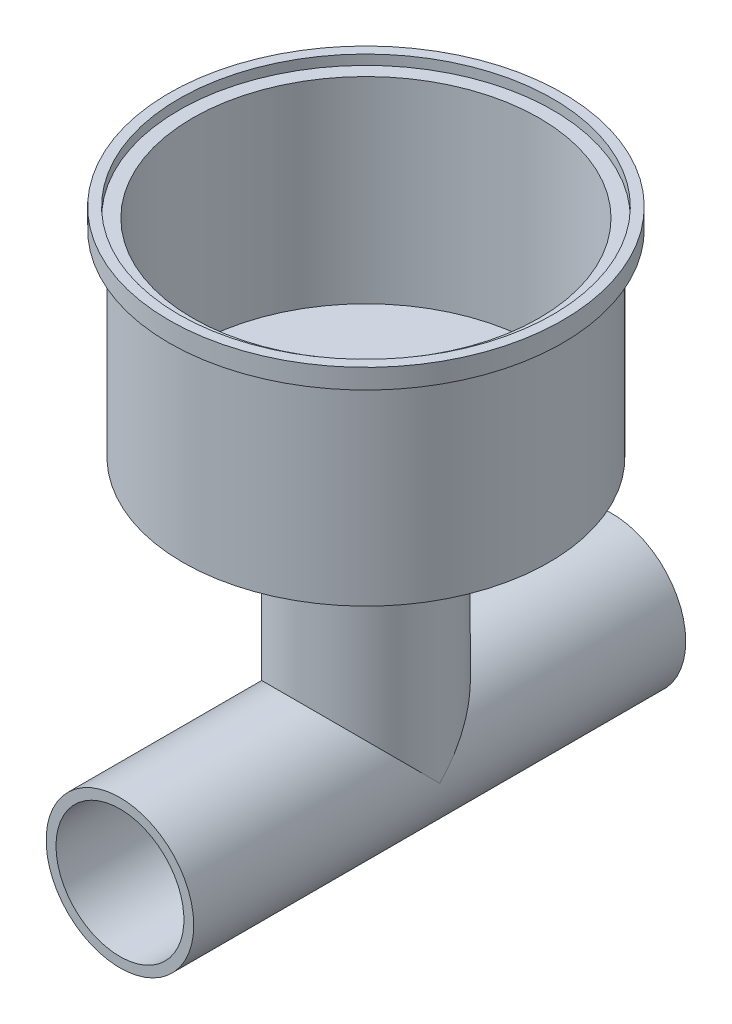
from build123d import *

# Parameters (mm, degrees)
SZKIC1_R                    = 7.5
DODANIE_WYCI_GNI_CIE1_DEPTH = 25
SZKIC3_R                    = 7.5
DODANIE_WYCI_GNI_CIE2_DEPTH = 25
SZKIC4_R                    = 18.61388964
DODANIE_WYCI_GNI_CIE3_DEPTH = 20
SZKIC5_R                    = 20
DODANIE_WYCI_GNI_CIE4_DEPTH = 2
SKORUPA1_START              = 26
SKORUPA1_OUTLINE_R          = 17.61388964
SKORUPA1_DEPTH              = 21
SKORUPA1_START_2            = -1e-07
SKORUPA1_2_OUTLINE_R        = 6.5
SKORUPA1_2_DEPTH            = 26.0000001
SKORUPA1_START_3            = 46
SKORUPA1_3_OUTLINE_R        = 19
SKORUPA1_3_OUTLINE_R_2      = 17.61388964
SKORUPA1_3_DEPTH            = 1
SKORUPA1_START_4            = -24
SKORUPA1_4_OUTLINE_R        = 6.5
SKORUPA1_4_DEPTH            = 48
SZKIC6_R                    = 6.5
WYTNIJ_WYCI_GNI_CIE1_DEPTH  = 72.477269114


with BuildPart() as part:
    # Szkic1 → Dodanie-wyciągnięcie1 (new, symmetric)
    with BuildSketch(Plane.XY):
        Circle(SZKIC1_R)
    extrude(amount=DODANIE_WYCI_GNI_CIE1_DEPTH, both=True)

    # Szkic3 → Dodanie-wyciągnięcie2 (add)
    with BuildSketch(Plane(origin=(0, 0, 0), x_dir=(1, 0, 0), z_dir=(0, 1, 0))):
        Circle(SZKIC3_R)
    extrude(amount=DODANIE_WYCI_GNI_CIE2_DEPTH)

    # Szkic4 → Dodanie-wyciągnięcie3 (add)
    with BuildSketch(Plane(origin=(0, 25, 0), x_dir=(1, 0, 0), z_dir=(0, 1, 0))):
        with Locations(Location((0, 0, 0), (0, 0, 270))):
            Circle(SZKIC4_R)
    extrude(amount=DODANIE_WYCI_GNI_CIE3_DEPTH)

    # Szkic5 → Dodanie-wyciągnięcie4 (add)
    with BuildSketch(Plane(origin=(0, 45, 0), x_dir=(1, 0, 0), z_dir=(0, 1, 0))):
        with Locations(Location((0, 0, 0), (0, 0, 270))):
            Circle(SZKIC5_R)
    extrude(amount=DODANIE_WYCI_GNI_CIE4_DEPTH)

    # Skorupa1: read off the stored shape, not the designer's step
    # Skorupa1 outline → Skorupa1 (cut)
    with BuildSketch(Plane(origin=(0, 0, 0), x_dir=(1, 0, 0), z_dir=(0, 1, 0)).offset(SKORUPA1_START)):
        Circle(SKORUPA1_OUTLINE_R)
    extrude(amount=SKORUPA1_DEPTH, mode=Mode.SUBTRACT)

    # Skorupa1 2 outline → Skorupa1 2 (cut)
    with BuildSketch(Plane(origin=(0, 0, 0), x_dir=(1, 0, 0), z_dir=(0, 1, 0)).offset(SKORUPA1_START_2)):
        Circle(SKORUPA1_2_OUTLINE_R)
    extrude(amount=SKORUPA1_2_DEPTH, mode=Mode.SUBTRACT)

    # Skorupa1 3 outline → Skorupa1 3 (cut)
    with BuildSketch(Plane(origin=(0, 0, 0), x_dir=(1, 0, 0), z_dir=(0, 1, 0)).offset(SKORUPA1_START_3)):
        Circle(SKORUPA1_3_OUTLINE_R)
        Circle(SKORUPA1_3_OUTLINE_R_2, mode=Mode.SUBTRACT)
    extrude(amount=SKORUPA1_3_DEPTH, mode=Mode.SUBTRACT)

    # Skorupa1 4 outline → Skorupa1 4 (cut)
    with BuildSketch(Plane.XY.offset(SKORUPA1_START_4)):
        Circle(SKORUPA1_4_OUTLINE_R)
    extrude(amount=SKORUPA1_4_DEPTH, mode=Mode.SUBTRACT)

    # Szkic6 → Wytnij-wyciągnięcie1 (cut, through all)
    with BuildSketch(Plane(origin=(0, 0, -25), x_dir=(-1, 0, 0), z_dir=(0, 0, -1))):
        Circle(SZKIC6_R)
    extrude(amount=-WYTNIJ_WYCI_GNI_CIE1_DEPTH, mode=Mode.SUBTRACT)


solid = part.part
